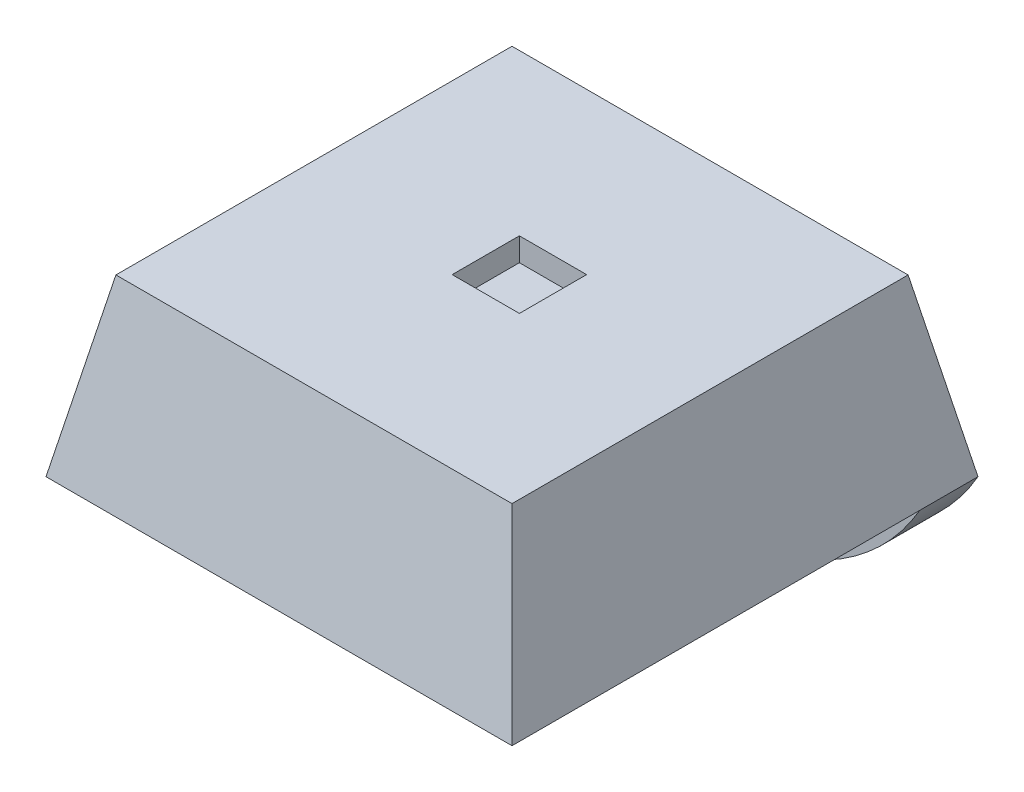
from build123d import *

# Parameters (mm, degrees)
SKETCH1_W               = 8
SKETCH1_H               = 8
BOSS_EXTRUDE1_DEPTH     = 3
CUT_EXTRUDE1_DEPTH      = 12.704699911
CUT_EXTRUDE1_DEPTH_BACK = 12.704699911
CUT_EXTRUDE2_DEPTH      = 11
SKETCH4_R               = 1.8
CUT_EXTRUDE3_DEPTH      = 0.8
SKETCH5_W               = 8
SKETCH5_H               = 1
BOSS_EXTRUDE2_DEPTH     = 2
FILLET1_R               = 4
SKETCH6_W               = 1.153846154
SKETCH6_H               = 1.153846154
CUT_EXTRUDE4_DEPTH      = 0.4


with BuildPart() as part:
    # Sketch1 → Boss-Extrude1 (new body)
    with BuildSketch(Plane(origin=(0, 0, 0), x_dir=(1, 0, 0), z_dir=(0, 1, 0))):
        with Locations((4, 4)):
            Rectangle(SKETCH1_W, SKETCH1_H)
    extrude(amount=BOSS_EXTRUDE1_DEPTH)

    # Sketch2 → Cut-Extrude1 (cut, two sides: drawn at the far end of the back side and taken through both)
    with BuildSketch(Plane.XY.offset(-CUT_EXTRUDE1_DEPTH_BACK)):
        Polygon((0, 0), (0.6, 3), (0, 3), align=None)
        Polygon((8, 0), (7.4, 3), (8, 3), align=None)
    extrude(amount=CUT_EXTRUDE1_DEPTH + CUT_EXTRUDE1_DEPTH_BACK, mode=Mode.SUBTRACT)

    # Sketch3 → Cut-Extrude2 (cut)
    with BuildSketch(Plane(origin=(0, 0, 0), x_dir=(0, 0, -1), z_dir=(1, 0, 0))):
        Polygon((0, 0), (0.6, 3), (0, 3), align=None)
        Polygon((8, 3), (7.4, 3), (8, 0), align=None)
    extrude(amount=CUT_EXTRUDE2_DEPTH, mode=Mode.SUBTRACT)

    # Sketch4 → Cut-Extrude3 (cut)
    with BuildSketch(Plane.XZ):
        with Locations(Location((4, -3.75, 0), (0, 0, 270))):
            Circle(SKETCH4_R)
    extrude(amount=-CUT_EXTRUDE3_DEPTH, mode=Mode.SUBTRACT)

    # Sketch5 → Boss-Extrude2 (add)
    with BuildSketch(Plane.XZ):
        with Locations((4, -7.5)):
            Rectangle(SKETCH5_W, SKETCH5_H)
    extrude(amount=BOSS_EXTRUDE2_DEPTH)

    # Fillet1
    # the kernel refuses this fillet: 4 mm, written as the material it takes off along each edge
    with BuildSketch(Plane(origin=(8, -2, -16.660254038), x_dir=(0, 1, 0), z_dir=(0, 0, 1)), Plane(origin=(0, -2, 1.660254038), x_dir=(0, 1, 0), z_dir=(0, 0, -1))) as fillet1_piece_1:
        with BuildLine():
            CenterArc((4, 3.464101615), FILLET1_R, 180, 60)
            Line((0, 3.464101615), (-0.08, 3.464101615))
            Line((-0.08, 3.464101615), (-0.08, 0))
            Line((-0.08, 0), (0, -0.08))
            ThreePointArc((0, -0.08), (1, -0.08), (1.96, -0.069282032))
            Line((1.96, -0.069282032), (2, 0))
        make_face()
    extrude(amount=18.320508076, mode=Mode.SUBTRACT)

    # Sketch6 → Cut-Extrude4 (cut)
    with BuildSketch(Plane(origin=(0, 3, 0), x_dir=(1, 0, 0), z_dir=(0, 1, 0))):
        with Locations((4.058809338, 4.067977948)):
            Rectangle(SKETCH6_W, SKETCH6_H)
    extrude(amount=-CUT_EXTRUDE4_DEPTH, mode=Mode.SUBTRACT)


solid = part.part
